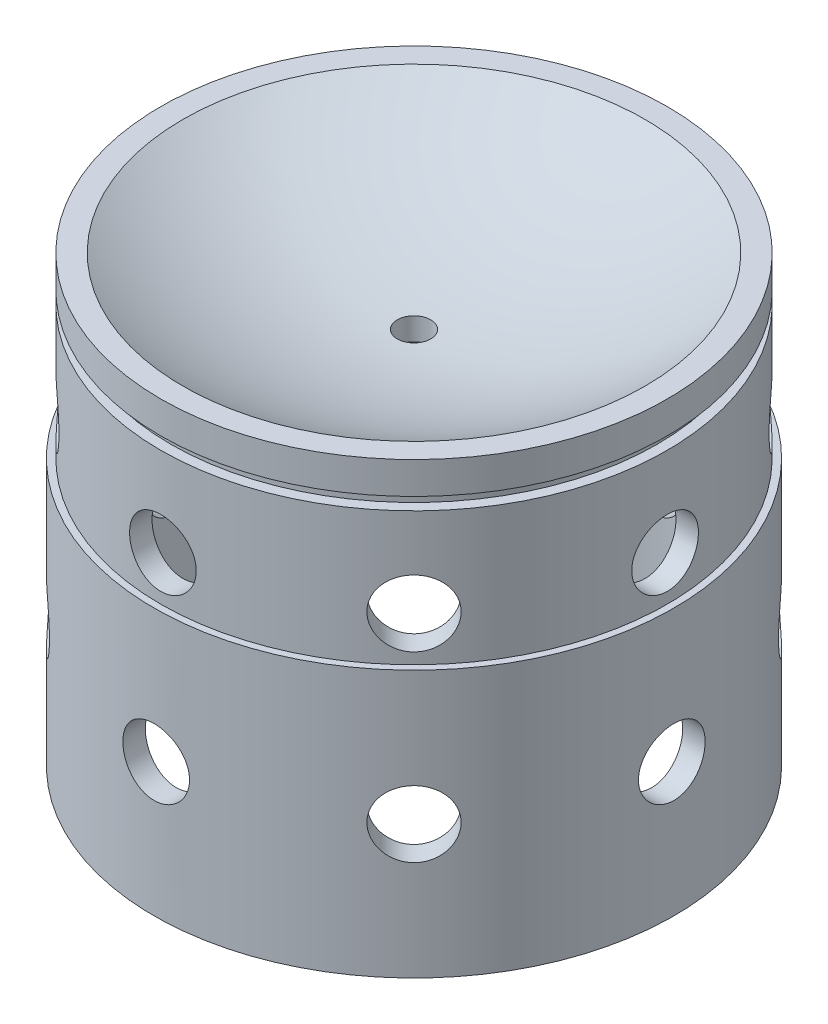
from build123d import *

# Parameters (mm, degrees)
MAIN_LINE_HOLE_REACH      = 148.158
MAIN_LINE_HOLE_END_RADIUS = 123.994333333
SKETCH10_R                = 4.7625
CHAMFER1_SIZE             = 2.54
SCALE1_SCALE              = 0.5
CIRPATTERN1_COUNT         = 8


with BuildPart() as part:
    # Sketch1 → Revolve1 (revolve)
    with BuildSketch(Plane.XY, mode=Mode.PRIVATE) as revolve1_sk:
        with BuildLine():
            Line((0, 6.35), (0, 0))
            Line((0, 0), (66.04, 0))
            Line((66.04, 0), (72.39, 0))
            Line((72.39, 0), (72.39, 12.7))
            Line((72.39, 12.7), (69.469, 12.7))
            Line((69.469, 12.7), (69.469, 16.256))
            Line((69.469, 16.256), (72.39, 16.256))
            Line((72.39, 16.256), (72.39, 25.4))
            Line((72.39, 25.4), (66.04, 25.4))
            ThreePointArc((66.04, 25.4), (34.366350184, 11.207652694), (0, 6.35))
        make_face()
        Polygon((72.39, 0), (66.04, 0), (66.04, -25.4), (67.945, -25.4), (72.39, -25.4), align=None)
        Polygon((74.295, -25.4), (72.39, -25.4), (67.945, -25.4), (67.945, -101.6), (74.295, -101.6), align=None)
    revolve(revolve1_sk.sketch.rotate(Axis((0, 0, 0), (0, 1, 0)), 90), axis=Axis((0, 0, 0), (0, 1, 0)))

    # Main Line Hole: up to this sphere (the profile starts outside it)
    main_line_hole_end = Location((0, 130.344333333, 0)) * Sphere(MAIN_LINE_HOLE_END_RADIUS, mode=Mode.PRIVATE)
    # Sketch10 → Main Line Hole (cut, up to the surface)
    with BuildSketch(Plane.XZ, mode=Mode.PRIVATE) as main_line_hole_sk1:
        with Locations(Location((0, 0, 0), (0, 0, 270))):
            Circle(SKETCH10_R)
    main_line_hole_tool1 = extrude(main_line_hole_sk1.sketch, amount=-MAIN_LINE_HOLE_REACH, mode=Mode.PRIVATE) - main_line_hole_end
    add(main_line_hole_tool1.solids().sort_by_distance((0, 0, 0))[0], mode=Mode.SUBTRACT)

    # Chamfer1
    # the kernel refuses this chamfer: 2.54 mm, written as the material it adds along each edge
    with BuildSketch(Plane(origin=(0, -25.4, 0), x_dir=(0, 0, -1), z_dir=(1, 0, 0))) as chamfer1_piece_1_section:
        Polygon((67.945 - CHAMFER1_SIZE, 0), (67.945, -CHAMFER1_SIZE), (67.945, 0), align=None)
    chamfer1_piece_1 = revolve(axis=Axis((0, -25.4, 0), (0, 1, 0)), mode=Mode.PRIVATE)
    chamfer1_piece_1 = chamfer1_piece_1 - Plane(origin=(0, -26.944579126, 0), x_dir=(0, 0, -1), z_dir=(0, -1, 0)) * Cylinder(66.04, 272, mode=Mode.PRIVATE)
    add(chamfer1_piece_1)


with BuildPart() as part_1:
    # Scale1: scaled about (0, -21.10158913, 0)
    add(part.part.scale(SCALE1_SCALE).moved(Location((0, -10.550794565, 0))))

    # Sketch9 → 3/8 (0.375) Diameter Hole2 (revolve, cut)
    with BuildSketch(Plane(origin=(37.1475, -42.300794565, 0), x_dir=(0, 0, -1), z_dir=(0, 1, 0))):
        Polygon((0, 0), (0, 40.008098698), (4.7625, 37.1465), (4.7625, 0), align=None)
    f_3_8_0_375_diameter_hole2 = revolve(axis=Axis((43.4975, -42.300794565, 0), (-1, 0, 0)), mode=Mode.SUBTRACT)

    # Sketch8 → 3/8 (0.375) Diameter Hole1 (revolve, cut)
    with BuildSketch(Plane(origin=(36.195, -16.900794565, 0), x_dir=(0, 0, -1), z_dir=(0, 1, 0))):
        Polygon((0, 0), (0, 39.055598698), (4.7625, 36.194), (4.7625, 0), align=None)
    f_3_8_0_375_diameter_hole1 = revolve(axis=Axis((42.545, -16.900794565, 0), (-1, 0, 0)), mode=Mode.SUBTRACT)

    # CirPattern1: 3/8 (0.375) Diameter Hole2, 3/8 (0.375) Diameter Hole1 ×8 about axis
    cirpattern1_axis = Axis((0, -23.250794565, 0), (0, -1, 0))
    add([f_3_8_0_375_diameter_hole2.rotate(cirpattern1_axis, i * 360 / CIRPATTERN1_COUNT) for i in range(1, CIRPATTERN1_COUNT)], mode=Mode.SUBTRACT)
    add([f_3_8_0_375_diameter_hole1.rotate(cirpattern1_axis, i * 360 / CIRPATTERN1_COUNT) for i in range(1, CIRPATTERN1_COUNT)], mode=Mode.SUBTRACT)


solid = part_1.part
